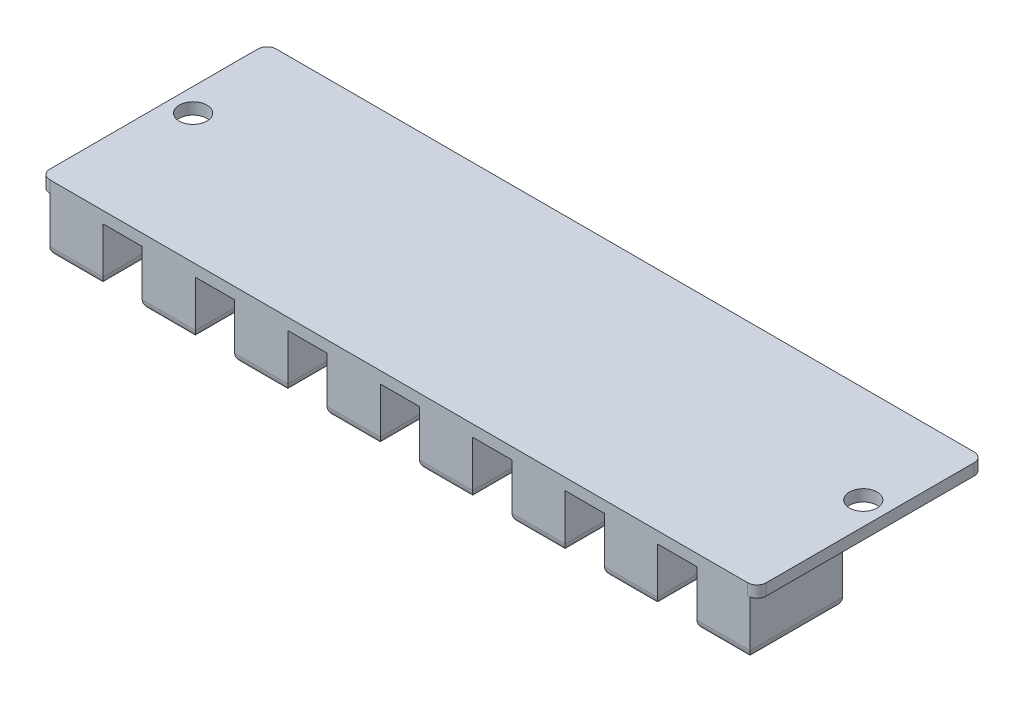
from build123d import *

# Parameters (mm, degrees)
SKETCH1_W           = 77.5
SKETCH1_H           = 24.5
BOSS_EXTRUDE1_DEPTH = 1.25
FILLET1_R           = 1
CUT_EXTRUDE1_REACH  = 42.659
SKETCH2_R           = 1.5
SKETCH3_W           = 5.75
SKETCH3_H           = 10
BOSS_EXTRUDE2_DEPTH = 6
FILLET2_R           = 1
LPATTERN1_START     = 2.25
LPATTERN1_DEPTH     = 10
LPATTERN1_START_2   = -37.75
LPATTERN1_2_DEPTH   = 76.75


with BuildPart() as part:
    # Sketch1 → Boss-Extrude1 (new body)
    with BuildSketch(Plane(origin=(0, 0, 0), x_dir=(1, 0, 0), z_dir=(0, 1, 0))):
        Rectangle(SKETCH1_W, SKETCH1_H)
    extrude(amount=BOSS_EXTRUDE1_DEPTH)

    # Fillet1
    fillet1_edges = [part.edges().sort_by_distance(p)[0] for p in [
        (38.75, 0.625, 12.25),
        (-38.75, 0.625, 12.25),
        (-38.75, 0.625, -12.25),
        (38.75, 0.625, -12.25),
    ]]
    fillet(fillet1_edges, radius=FILLET1_R)

    # Sketch2 → Cut-Extrude1 (cut, up to next)
    with BuildSketch(Plane.XZ, mode=Mode.PRIVATE) as cut_extrude1_sk1:
        with Locations(Location((36.25, -1.75, 0), (0, 0, 270))):
            Circle(SKETCH2_R)
    cut_extrude1_tool1 = extrude(cut_extrude1_sk1.sketch, amount=-CUT_EXTRUDE1_REACH, mode=Mode.PRIVATE) & part.part
    # Sketch2 → Cut-Extrude1 (cut, up to next)
    with BuildSketch(Plane.XZ, mode=Mode.PRIVATE) as cut_extrude1_sk2:
        with Locations(Location((-36.25, -1.75, 0), (0, 0, 90))):
            Circle(SKETCH2_R)
    cut_extrude1_tool2 = extrude(cut_extrude1_sk2.sketch, amount=-CUT_EXTRUDE1_REACH, mode=Mode.PRIVATE) & part.part
    add(cut_extrude1_tool1.solids().sort_by_distance((36.25, 0, -1.75))[0], mode=Mode.SUBTRACT)
    add(cut_extrude1_tool2.solids().sort_by_distance((-36.25, 0, -1.75))[0], mode=Mode.SUBTRACT)

    # Sketch3 → Boss-Extrude2 (add)
    with BuildSketch(Plane.XZ):
        with Locations((-34.875, 7.25)):
            Rectangle(SKETCH3_W, SKETCH3_H)
    extrude(amount=BOSS_EXTRUDE2_DEPTH)

    # Fillet2
    fillet2_edges = [part.edges().sort_by_distance(p)[0] for p in [
        (-37.75, -6, 7.25),
        (-34.875, -6, 2.25),
        (-32, -6, 7.25),
        (-34.875, -6, 12.25),
    ]]
    fillet(fillet2_edges, radius=FILLET2_R)

    # LPattern1: read off the stored shape, not the designer's step
    # LPattern1 outline → LPattern1 (add)
    with BuildSketch(Plane.XY.offset(LPATTERN1_START)):
        with BuildLine():
            ThreePointArc((-27.75, -5), (-27.457106781, -5.707106781), (-26.75, -6))
            Line((-26.75, -6), (-23, -6))
            ThreePointArc((-23, -6), (-22.292893219, -5.707106781), (-22, -5))
            Line((-22, -5), (-22, 0))
            Line((-22, 0), (-27.75, 0))
            Line((-27.75, 0), (-27.75, -5))
        make_face()
        with BuildLine():
            Line((38, 0), (32.25, 0))
            Line((32.25, 0), (32.25, -5))
            ThreePointArc((32.25, -5), (32.542893219, -5.707106781), (33.25, -6))
            Line((33.25, -6), (37, -6))
            ThreePointArc((37, -6), (37.707106781, -5.707106781), (38, -5))
            Line((38, -5), (38, 0))
        make_face()
        with BuildLine():
            Line((28, 0), (22.25, 0))
            Line((22.25, 0), (22.25, -5))
            ThreePointArc((22.25, -5), (22.542893219, -5.707106781), (23.25, -6))
            Line((23.25, -6), (27, -6))
            ThreePointArc((27, -6), (27.707106781, -5.707106781), (28, -5))
            Line((28, -5), (28, 0))
        make_face()
        with BuildLine():
            Line((18, 0), (12.25, 0))
            Line((12.25, 0), (12.25, -5))
            ThreePointArc((12.25, -5), (12.542893219, -5.707106781), (13.25, -6))
            Line((13.25, -6), (17, -6))
            ThreePointArc((17, -6), (17.707106781, -5.707106781), (18, -5))
            Line((18, -5), (18, 0))
        make_face()
        with BuildLine():
            Line((8, 0), (2.25, 0))
            Line((2.25, 0), (2.25, -5))
            ThreePointArc((2.25, -5), (2.542893219, -5.707106781), (3.25, -6))
            Line((3.25, -6), (7, -6))
            ThreePointArc((7, -6), (7.707106781, -5.707106781), (8, -5))
            Line((8, -5), (8, 0))
        make_face()
        with BuildLine():
            Line((-2, 0), (-7.75, 0))
            Line((-7.75, 0), (-7.75, -5))
            ThreePointArc((-7.75, -5), (-7.457106781, -5.707106781), (-6.75, -6))
            Line((-6.75, -6), (-3, -6))
            ThreePointArc((-3, -6), (-2.292893219, -5.707106781), (-2, -5))
            Line((-2, -5), (-2, 0))
        make_face()
        with BuildLine():
            Line((-12, 0), (-17.75, 0))
            Line((-17.75, 0), (-17.75, -5))
            ThreePointArc((-17.75, -5), (-17.457106781, -5.707106781), (-16.75, -6))
            Line((-16.75, -6), (-13, -6))
            ThreePointArc((-13, -6), (-12.292893219, -5.707106781), (-12, -5))
            Line((-12, -5), (-12, 0))
        make_face()
    extrude(amount=LPATTERN1_DEPTH)

    # LPattern1 2 outline → LPattern1 2 (cut)
    with BuildSketch(Plane.YZ.offset(LPATTERN1_START_2)):
        with BuildLine():
            Line((-6, 2.25), (-5, 2.25))
            ThreePointArc((-5, 2.25), (-5.707106781, 2.542893219), (-6, 3.25))
            Line((-6, 3.25), (-6, 2.25))
        make_face()
        with BuildLine():
            Line((-6, 12.25), (-6, 11.25))
            ThreePointArc((-6, 11.25), (-5.707106781, 11.957106781), (-5, 12.25))
            Line((-5, 12.25), (-6, 12.25))
        make_face()
    extrude(amount=LPATTERN1_2_DEPTH, mode=Mode.SUBTRACT)


solid = part.part
